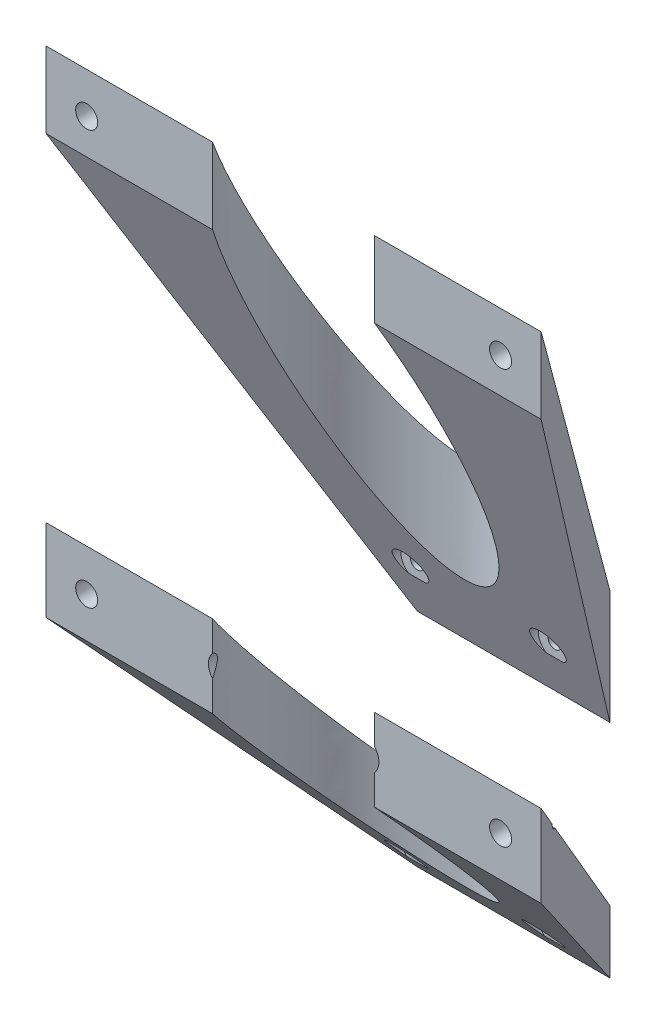
from build123d import *

# Parameters (mm, degrees)
SKETCH_5_R               = 1.25
CUT_EXTRUDE_1_DEPTH      = 122.037184526
CUT_EXTRUDE_START        = -5
SKETCH_6_R               = 3
CUT_EXTRUDE_2_DEPTH      = 117.037184526
SKETCH_7_R               = 2
CUT_EXTRUDE_3_DEPTH      = 122.037184526
CUT_EXTRUDE_START_2      = -3
SKETCH_8_R               = 3
CUT_EXTRUDE_4_DEPTH      = 119.037184526
CUT_EXTRUDE_5_DEPTH      = 122.037184526
CUT_EXTRUDE_5_DEPTH_BACK = 122.037184526
SKETCH_12_RX             = 20.465266771
SKETCH_12_RY             = 17.235422909


with BuildPart() as part:
    # Loft 1: read off the stored shape, not the designer's step
    # Loft 1: loft between two sections, ruled curve by curve
    loft_1_from = [
        Edge.make_line((-17.5, 30.5, 0), (17.5, 30.5, 0)),
        Edge.make_line((17.5, 30.5, 0), (17.5, -30.5, 0)),
        Edge.make_line((-17.5, -30.5, 0), (17.5, -30.5, 0)),
        Edge.make_line((-17.5, 30.5, 0), (-17.5, -30.5, 0)),
    ]
    loft_1_to = [
        Edge.make_line((-45, 105, 40), (45, 105, 40)),
        Edge.make_line((45, 105, 40), (45, 15, 40)),
        Edge.make_line((-45, 15, 40), (45, 15, 40)),
        Edge.make_line((-45, 105, 40), (-45, 15, 40)),
    ]
    loft_1 = Solid(Shell([*[Face.make_surface_from_curves(loft_1_from[k], loft_1_to[k]) for k in range(4)], Face(Wire(loft_1_from)), Face(Wire(loft_1_to))]))
    add(loft_1)

    # 草图5 → 切除-拉伸1 (cut, through all)
    with BuildSketch(Plane(origin=(0, 0, 0), x_dir=(-1, 0, 0), z_dir=(0, 0, -1))):
        with Locations((-12.5, 22.5)):
            Circle(SKETCH_5_R)
        with Locations((12.5, 22.5)):
            Circle(SKETCH_5_R)
        with Locations((12.5, -22.5)):
            Circle(SKETCH_5_R)
        with Locations((-12.5, -22.5)):
            Circle(SKETCH_5_R)
    extrude(amount=-CUT_EXTRUDE_1_DEPTH, mode=Mode.SUBTRACT)

    # 草图6 → 切除-拉伸2 (cut, through all)
    with BuildSketch(Plane(origin=(0, 0, 0), x_dir=(-1, 0, 0), z_dir=(0, 0, -1)).offset(CUT_EXTRUDE_START)):
        with Locations((-12.5, 22.5)):
            Circle(SKETCH_6_R)
        with Locations((12.5, 22.5)):
            Circle(SKETCH_6_R)
        with Locations((-12.5, -22.5)):
            Circle(SKETCH_6_R)
        with Locations((12.5, -22.5)):
            Circle(SKETCH_6_R)
    extrude(amount=-CUT_EXTRUDE_2_DEPTH, mode=Mode.SUBTRACT)

    # 草图7 → 切除-拉伸3 (cut, through all)
    with BuildSketch(Plane.XY.offset(40)):
        with Locations((37.625, 22.375)):
            Circle(SKETCH_7_R)
        with Locations((-37.625, 22.375)):
            Circle(SKETCH_7_R)
        with Locations((-37.625, 97.625)):
            Circle(SKETCH_7_R)
        with Locations((37.625, 97.625)):
            Circle(SKETCH_7_R)
    extrude(amount=-CUT_EXTRUDE_3_DEPTH, mode=Mode.SUBTRACT)

    # 草图8 → 切除-拉伸4 (cut, through all)
    with BuildSketch(Plane.XY.offset(40).offset(CUT_EXTRUDE_START_2)):
        with Locations((-37.625, 97.625)):
            Circle(SKETCH_8_R)
        with Locations((37.625, 97.625)):
            Circle(SKETCH_8_R)
        with Locations((37.625, 22.375)):
            Circle(SKETCH_8_R)
        with Locations((-37.625, 22.375)):
            Circle(SKETCH_8_R)
    extrude(amount=-CUT_EXTRUDE_4_DEPTH, mode=Mode.SUBTRACT)

    # 草图11 → Loft 1 2 section 0
    with BuildSketch(Plane.XY.offset(40)):
        with BuildLine():
            Line((-45, 91.216125502), (45, 91.216125502))
            Line((45, 91.216125502), (45, 29.943379718))
            Line((45, 29.943379718), (-45, 29.943379718))
            Line((-45, 29.943379718), (-45, 91.216125502))
        make_face()
    # 草图9 → Loft 1 2 section 1
    with BuildSketch(Plane(origin=(0, 0, 0), x_dir=(-1, 0, 0), z_dir=(0, 0, -1))):
        with BuildLine():
            Line((-17.5, 9.752727906), (17.5, 9.752727906))
            Line((17.5, 9.752727906), (17.5, -19.101844067))
            Line((17.5, -19.101844067), (-17.5, -19.101844067))
            Line((-17.5, -19.101844067), (-17.5, 9.752727906))
        make_face()
    loft(mode=Mode.SUBTRACT)


with BuildPart() as loft_1_2_piece_1:
    # of the separate pieces the step leaves, piece 1, a body of its own (loft_1_2_pieces)
    add(part.part.solids().sort_by_distance((-17.5, 30.5, 0))[0])


with BuildPart() as loft_1_2_piece_2:
    # of the separate pieces the step leaves, piece 2, a body of its own (loft_1_2_pieces)
    add(part.part.solids().sort_by_distance((-17.5, -19.101844067, 0))[0])


with BuildPart() as cut_extrude_5_tool:
    # 草图12 → 切除-拉伸5 (new, two sides: drawn at the far end of the back side and taken through both)
    with BuildSketch(Plane(origin=(0, 0, 0), x_dir=(1, 0, 0), z_dir=(0, 1, 0)).offset(-CUT_EXTRUDE_5_DEPTH_BACK)):
        with Locations(Location((0, -29.400447007), (0, 0, -90))):
            Ellipse(SKETCH_12_RX, SKETCH_12_RY)
    extrude(amount=CUT_EXTRUDE_5_DEPTH + CUT_EXTRUDE_5_DEPTH_BACK)


with BuildPart() as loft_1_2_piece_1_1:
    add(loft_1_2_piece_1.part)

    # 切除-拉伸5: cut by cut_extrude_5_tool
    add(cut_extrude_5_tool.part, mode=Mode.SUBTRACT)


with BuildPart() as loft_1_2_piece_2_1:
    add(loft_1_2_piece_2.part)

    # 切除-拉伸5: cut by cut_extrude_5_tool
    add(cut_extrude_5_tool.part, mode=Mode.SUBTRACT)


solid = Compound([loft_1_2_piece_1_1.part, loft_1_2_piece_2_1.part])
